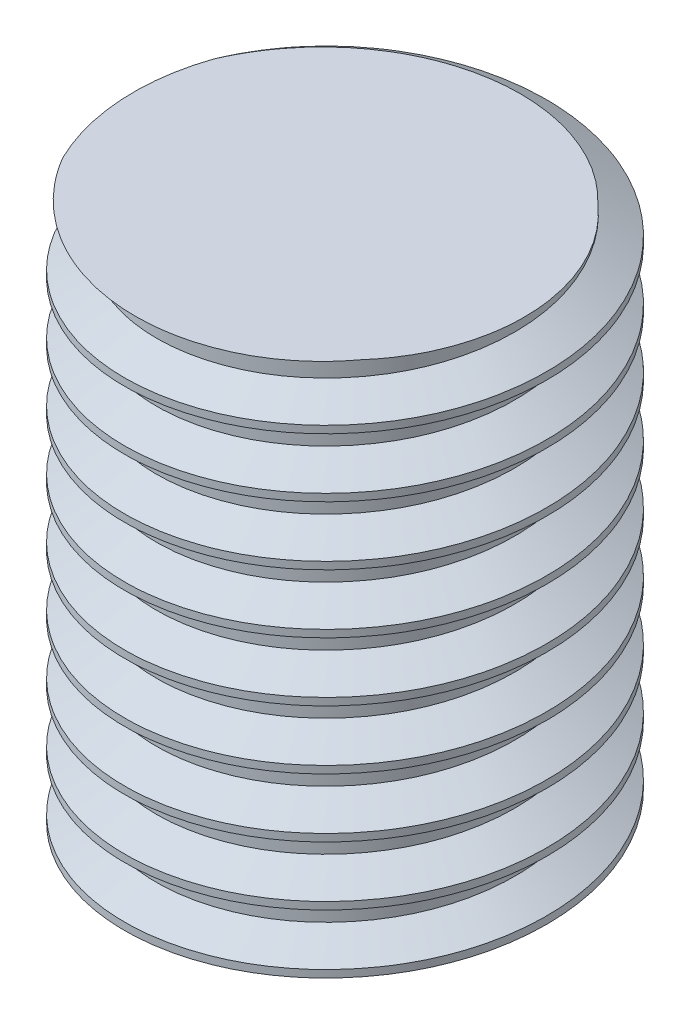
from build123d import *

# Parameters (mm, degrees)
SKETCH1_R           = 7.5819
BOSS_EXTRUDE2_DEPTH = 19.05
SKETCH2_R           = 5.9944
CUT_EXTRUDE1_DEPTH  = 12.7
THREAD1_PITCH       = 2.116666667


with BuildPart() as part:
    # Sketch1 → Boss-Extrude2 (new body)
    with BuildSketch(Plane(origin=(0, 0, 0), x_dir=(1, 0, 0), z_dir=(0, 1, 0))):
        with Locations(Location((0, 0, 0), (0, 0, 90))):
            Circle(SKETCH1_R)
    extrude(amount=BOSS_EXTRUDE2_DEPTH)

    # Sketch2 → Cut-Extrude1 (cut)
    with BuildSketch(Plane.XZ):
        with Locations(Location((0, 0, 0), (0, 0, 270))):
            Circle(SKETCH2_R)
    extrude(amount=-CUT_EXTRUDE1_DEPTH, mode=Mode.SUBTRACT)

    # Thread1: arcs per turn and ends read off the stored shape
    # Thread1: the profile of Thread Profile1 profile screwed along a right-hand helix through 12 turns, 10 arcs to a turn; built about Z, then put on its axis
    thread1_z = Axis((0, 0, 0), (0, 0, 1))
    thread1_corners = [(7.5822, 0, -25.400173205), (7.5822, 0, -23.547743467), (6.436220565, 0, -24.209375003), (6.436220565, 0, -24.73854167)]
    with BuildLine(mode=Mode.PRIVATE) as thread1_profile:
        Line(thread1_corners[0], thread1_corners[1])
        Line(thread1_corners[1], thread1_corners[2])
        Line(thread1_corners[2], thread1_corners[3])
        Line(thread1_corners[3], thread1_corners[0])
    thread1_cap = Face(thread1_profile.wire())
    thread1_turn_angles = [0, 18, 36, 54, 72, 90, 108, 126, 144, 162, 180, 198, 216, 234, 252, 270, 288, 306, 324, 342, 360]
    thread1_turn_weights = [1, 0.9510565162951535, 1, 0.9510565162951535, 1, 0.9510565162951535, 1, 0.9510565162951535, 1, 0.9510565162951535, 1, 0.9510565162951535, 1, 0.9510565162951535, 1, 0.9510565162951535, 1, 0.9510565162951535, 1, 0.9510565162951535, 1]
    thread1_turn_rails = [Edge.make_bspline([Vector(p[0], p[1], 0).rotate(thread1_z, thread1_turn_angles[k]) / thread1_turn_weights[k] + Vector(0, 0, p[2] + THREAD1_PITCH * thread1_turn_angles[k] / 360) for k in range(21)], [0, 0, 0, 1, 1, 2, 2, 3, 3, 4, 4, 5, 5, 6, 6, 7, 7, 8, 8, 9, 9, 10, 10, 10], 2, thread1_turn_weights) for p in thread1_corners]
    thread1_turn_sides = [Face.make_surface_from_curves(thread1_turn_rails[p[0]], thread1_turn_rails[p[1]]) for p in [(0, 1), (1, 2), (2, 3), (3, 0)]]
    thread1 = Plane(origin=(0, -2.27, 0), x_dir=(-1, 0, 0), z_dir=(0, -1, 0)) * Solid(Shell([*[p.moved(Location((0, 0, THREAD1_PITCH * i))) for i in range(12) for p in thread1_turn_sides], thread1_cap, thread1_cap.rotate(thread1_z, 4320).moved(Location((0, 0, THREAD1_PITCH * 4320 / 360)))]))
    add(thread1, mode=Mode.SUBTRACT)


solid = part.part
